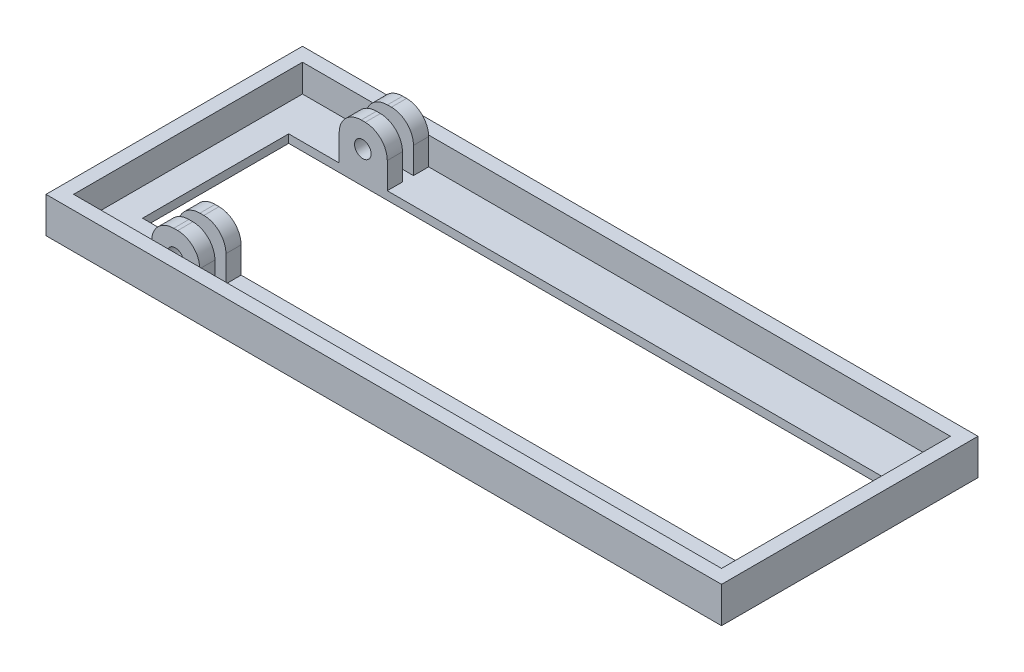
from build123d import *

# Parameters (mm, degrees)
SKETCH4_W               = 2449.5
SKETCH4_H               = 930
SKETCH4_W_2             = 2149.5
SKETCH4_H_2             = 530
BOSS_EXTRUDE2_DEPTH     = 30
SKETCH6_W               = 2449.5
SKETCH6_H               = 930
SKETCH6_W_2             = 2349.5
SKETCH6_H_2             = 830
BOSS_EXTRUDE3_DEPTH     = 100
SKETCH8_W               = 174.417097876
SKETCH8_H               = 150
BOSS_EXTRUDE4_DEPTH     = 175
CUT_EXTRUDE1_DEPTH      = 680
CUT_EXTRUDE1_DEPTH_BACK = 150
SKETCH10_R              = 30
FILLET1_R               = 80
SKETCH12_W              = 40
SKETCH12_H              = 200
CUT_EXTRUDE2_DEPTH      = 184


with BuildPart() as part:
    # Sketch4 → Boss-Extrude2 (new body)
    with BuildSketch(Plane(origin=(0, 0, 0), x_dir=(1, 0, 0), z_dir=(0, 1, 0))):
        with Locations((2350.564429087, 865.22075714)):
            Rectangle(SKETCH4_W, SKETCH4_H)
        with Locations((2350.564429087, 865.22075714)):
            Rectangle(SKETCH4_W_2, SKETCH4_H_2, mode=Mode.SUBTRACT)
    extrude(amount=BOSS_EXTRUDE2_DEPTH)

    # Sketch6 → Boss-Extrude3 (add)
    with BuildSketch(Plane(origin=(0, 30, 0), x_dir=(1, 0, 0), z_dir=(0, 1, 0))):
        with Locations((2350.564429087, 865.22075714)):
            Rectangle(SKETCH6_W, SKETCH6_H)
        with Locations((2350.564429087, 865.22075714)):
            Rectangle(SKETCH6_W_2, SKETCH6_H_2, mode=Mode.SUBTRACT)
    extrude(amount=BOSS_EXTRUDE3_DEPTH)

    # Sketch8 → Boss-Extrude4 (add)
    with BuildSketch(Plane(origin=(0, 30, 0), x_dir=(1, 0, 0), z_dir=(0, 1, 0))):
        with Locations((1546.094821657, 1205.22075714)):
            Rectangle(SKETCH8_W, SKETCH8_H)
        with Locations((1546.094821657, 525.22075714)):
            Rectangle(SKETCH8_W, SKETCH8_H)
    extrude(amount=BOSS_EXTRUDE4_DEPTH)

    # Sketch10 → Cut-Extrude1 (cut, two sides: drawn at the far end of the back side and taken through both)
    with BuildSketch(Plane.XY.offset(-1130.22075714).offset(-CUT_EXTRUDE1_DEPTH_BACK)):
        with Locations(Location((1544.625999864, 116.419579706, 0), (0, 0, 180))):
            Circle(SKETCH10_R)
    extrude(amount=CUT_EXTRUDE1_DEPTH + CUT_EXTRUDE1_DEPTH_BACK, mode=Mode.SUBTRACT)

    # Fillet1
    # the kernel refuses this fillet: 80 mm, written as the material it takes off along each edge
    with BuildSketch(Plane(origin=(1633.303370595, 205, -1280.22075714), x_dir=(0, -1, 0), z_dir=(0, 0, 1)), Plane(origin=(1458.886272719, 205, -450.22075714), x_dir=(0, -1, 0), z_dir=(0, 0, -1))) as fillet1_piece_1:
        with BuildLine():
            CenterArc((FILLET1_R, -FILLET1_R), FILLET1_R, 90, 90)
            Line((0, -FILLET1_R), (0, 0))
            Line((0, 0), (FILLET1_R, 0))
        make_face()
    extrude(amount=350, mode=Mode.SUBTRACT)
    with BuildSketch(Plane(origin=(1458.886272719, 205, -930.22075714), x_dir=(1, 0, 0), z_dir=(0, 0, -1)), Plane(origin=(1633.303370595, 205, -800.22075714), x_dir=(-1, 0, 0), z_dir=(0, 0, 1))) as fillet1_piece_2:
        with BuildLine():
            CenterArc((FILLET1_R, FILLET1_R), FILLET1_R, 180, 90)
            Line((0, FILLET1_R), (0, 0))
            Line((0, 0), (FILLET1_R, 0))
        make_face()
    extrude(amount=350, mode=Mode.SUBTRACT)

    # Sketch12 → Cut-Extrude2 (cut)
    with BuildSketch(Plane(origin=(1633.303370595, 0, 0), x_dir=(0, 0, -1), z_dir=(1, 0, 0))):
        with Locations((1205.22075714, 130)):
            Rectangle(SKETCH12_W, SKETCH12_H)
        with Locations((525.22075714, 130)):
            Rectangle(SKETCH12_W, SKETCH12_H)
    extrude(amount=-CUT_EXTRUDE2_DEPTH, mode=Mode.SUBTRACT)


solid = part.part
